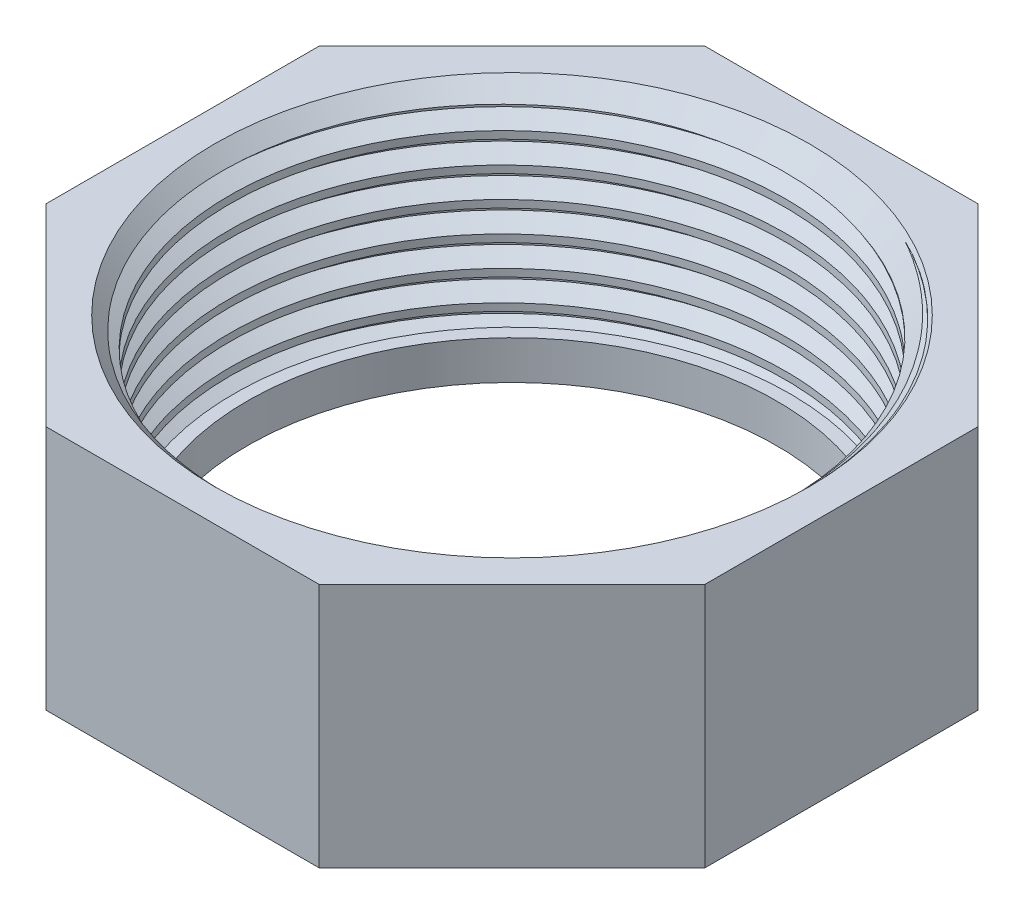
from build123d import *

# Parameters (mm, degrees)
ESBO_O1_R                = 20.5
RESSALTO_EXTRUS_O1_DEPTH = 19
ESBO_O2_R                = 21.5
CORTE_EXTRUS_O1_DEPTH    = 16
CHANFRO1_SIZE            = 1.5
ROSCA1_PITCH             = 2.309090909


with BuildPart() as part:
    # Esboço1 → Ressalto-extrusão1 (new body)
    with BuildSketch(Plane(origin=(0, 0, 0), x_dir=(1, 0, 0), z_dir=(0, 1, 0))):
        Polygon((10.562445841, -25.5), (25.5, -10.562445841), (25.5, 10.562445841), (10.562445841, 25.5), (-10.562445841, 25.5), (-25.5, 10.562445841), (-25.5, -10.562445841), (-10.562445841, -25.5), align=None)
        with Locations(Location((0, 0, 0), (0, 0, 270))):
            Circle(ESBO_O1_R, mode=Mode.SUBTRACT)
    extrude(amount=RESSALTO_EXTRUS_O1_DEPTH)

    # Esboço2 → Corte-extrusão1 (cut)
    with BuildSketch(Plane(origin=(0, 19, 0), x_dir=(1, 0, 0), z_dir=(0, 1, 0))):
        with Locations(Location((0, 0, 0), (0, 0, 270))):
            Circle(ESBO_O2_R)
    extrude(amount=-CORTE_EXTRUS_O1_DEPTH, mode=Mode.SUBTRACT)

    # Chanfro1
    chanfro1_edges = [part.edges().sort_by_distance(p)[0] for p in [
        (0, 19, -21.5),
    ]]
    chamfer(chanfro1_edges, length=CHANFRO1_SIZE)

    # Rosca1: the profile of Perfil da rosca1 profile screwed along a right-hand helix of 7.57874 turns, 10 arcs to a turn; built about Z, then put on its axis
    rosca1_z = Axis((0, 0, 0), (0, 0, 1))
    rosca1_corners = [(21.4997, 0, -0.000173205), (22.749832111, 0, 0.721590906), (22.749832111, 0, 1.01022727), (21.4997, 0, 1.731991381)]
    with BuildLine(mode=Mode.PRIVATE) as rosca1_profile:
        Line(rosca1_corners[0], rosca1_corners[1])
        Line(rosca1_corners[1], rosca1_corners[2])
        Line(rosca1_corners[2], rosca1_corners[3])
        Line(rosca1_corners[3], rosca1_corners[0])
    rosca1_cap = Face(rosca1_profile.wire())
    rosca1_turn_angles = [0, 18, 36, 54, 72, 90, 108, 126, 144, 162, 180, 198, 216, 234, 252, 270, 288, 306, 324, 342, 360]
    rosca1_turn_weights = [1, 0.9510565162951535, 1, 0.9510565162951535, 1, 0.9510565162951535, 1, 0.9510565162951535, 1, 0.9510565162951535, 1, 0.9510565162951535, 1, 0.9510565162951535, 1, 0.9510565162951535, 1, 0.9510565162951535, 1, 0.9510565162951535, 1]
    rosca1_turn_rails = [Edge.make_bspline([Vector(p[0], p[1], 0).rotate(rosca1_z, rosca1_turn_angles[k]) / rosca1_turn_weights[k] + Vector(0, 0, p[2] + ROSCA1_PITCH * rosca1_turn_angles[k] / 360) for k in range(21)], [0, 0, 0, 1, 1, 2, 2, 3, 3, 4, 4, 5, 5, 6, 6, 7, 7, 8, 8, 9, 9, 10, 10, 10], 2, rosca1_turn_weights) for p in rosca1_corners]
    rosca1_turn_sides = [Face.make_surface_from_curves(rosca1_turn_rails[p[0]], rosca1_turn_rails[p[1]]) for p in [(0, 1), (1, 2), (2, 3), (3, 0)]]
    rosca1_last_angles = [2520, 2538, 2556, 2574, 2592, 2610, 2628, 2646, 2664, 2682, 2700, 2714.173228346, 2728.346456693]
    rosca1_last_weights = [1, 0.9510565162951535, 1, 0.9510565162951535, 1, 0.9510565162951535, 1, 0.9510565162951535, 1, 0.9510565162951535, 1, 0.9695598647982477, 1]
    rosca1_last_rails = [Edge.make_bspline([Vector(p[0], p[1], 0).rotate(rosca1_z, rosca1_last_angles[k]) / rosca1_last_weights[k] + Vector(0, 0, p[2] + ROSCA1_PITCH * rosca1_last_angles[k] / 360) for k in range(13)], [0, 0, 0, 1, 1, 2, 2, 3, 3, 4, 4, 5, 5, 6, 6, 6], 2, rosca1_last_weights) for p in rosca1_corners]
    rosca1_last_sides = [Face.make_surface_from_curves(rosca1_last_rails[p[0]], rosca1_last_rails[p[1]]) for p in [(0, 1), (1, 2), (2, 3), (3, 0)]]
    rosca1 = Plane(origin=(0, 20.5, 0), x_dir=(-1, 0, 0), z_dir=(0, -1, 0)) * Solid(Shell([*[p.moved(Location((0, 0, ROSCA1_PITCH * i))) for i in range(7) for p in rosca1_turn_sides], *rosca1_last_sides, rosca1_cap, rosca1_cap.rotate(rosca1_z, 2728.346456693).moved(Location((0, 0, ROSCA1_PITCH * 2728.346456693 / 360)))]))
    add(rosca1, mode=Mode.SUBTRACT)


solid = part.part
